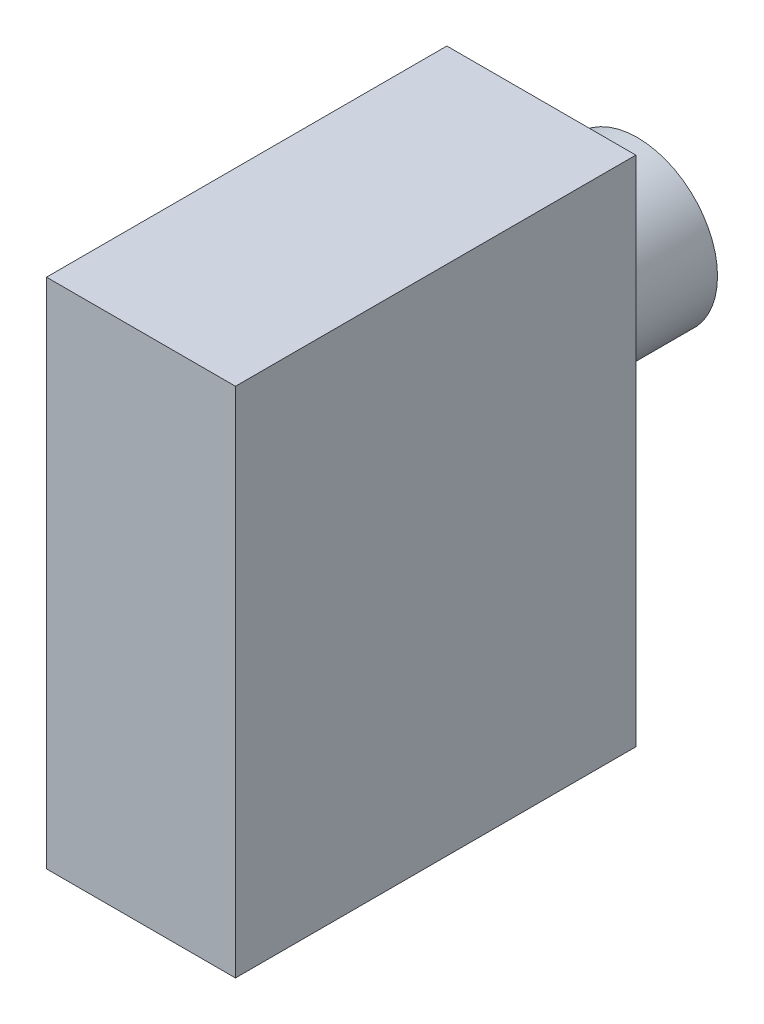
from build123d import *

# Parameters (mm, degrees)
CROQUIS1_W              = 11.8
CROQUIS1_H              = 32
SALIENTE_EXTRUIR2_DEPTH = 25
CROQUIS2_R              = 5
SALIENTE_EXTRUIR3_DEPTH = 6


with BuildPart() as part:
    # Croquis1 → Saliente-Extruir2 (new body)
    with BuildSketch(Plane.XY):
        with Locations((0, 16)):
            Rectangle(CROQUIS1_W, CROQUIS1_H)
    extrude(amount=SALIENTE_EXTRUIR2_DEPTH)

    # Croquis2 → Saliente-Extruir3 (add)
    with BuildSketch(Plane(origin=(0, 0, 0), x_dir=(-1, 0, 0), z_dir=(0, 0, -1))):
        with Locations((0, 22)):
            Circle(CROQUIS2_R)
    extrude(amount=SALIENTE_EXTRUIR3_DEPTH)


solid = part.part
